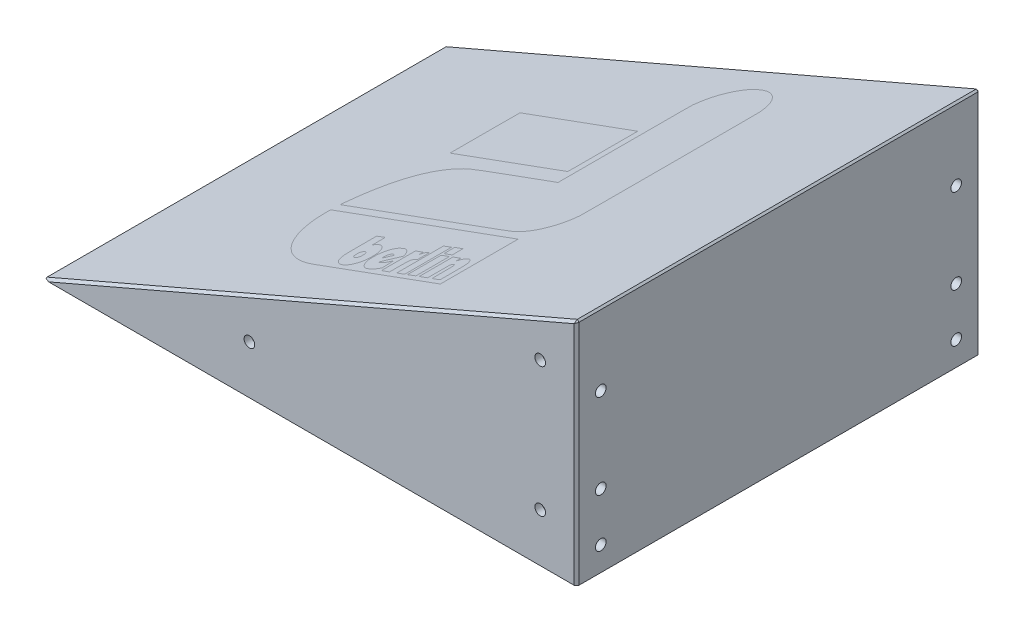
from build123d import *

# Parameters (mm, degrees)
BOSS_EXTRUDE1_DEPTH   = 166.666666667
CUT_EXTRUDE1_DEPTH    = 160.666666667
SKETCH3_R             = 2.2
CUT_EXTRUDE2_DEPTH    = 5
SKETCH4_R             = 2.2
CUT_EXTRUDE3_DEPTH    = 163.666666667
CUT_EXTRUDE4_DEPTH    = 1
BOSS_EXTRUDE2_DEPTH   = 1
BOSS_EXTRUDE2_2_DEPTH = 1
BOSS_EXTRUDE2_3_DEPTH = 1
BOSS_EXTRUDE2_4_DEPTH = 1
BOSS_EXTRUDE2_5_DEPTH = 1


with BuildPart() as part:
    # Sketch1 → Boss-Extrude1 (new body)
    with BuildSketch(Plane.XY):
        Polygon((0, 0), (-220.397368405, 0), (0, 95), align=None)
    extrude(amount=BOSS_EXTRUDE1_DEPTH)

    # Sketch2 → Cut-Extrude1 (cut)
    with BuildSketch(Plane.XY.offset(163.666666667)):
        Polygon((-5, 0), (-5, 87.400090745), (-178.22131418, 12.734839675), (-178.22131418, 0), align=None)
    extrude(amount=-CUT_EXTRUDE1_DEPTH, mode=Mode.SUBTRACT)

    # Sketch3 → Cut-Extrude2 (cut)
    with BuildSketch(Plane(origin=(0, 0, 0), x_dir=(0, 0, -1), z_dir=(1, 0, 0))):
        with Locations((-156.666666667, 10)):
            Circle(SKETCH3_R)
        with Locations((-156.666666667, 65)):
            Circle(SKETCH3_R)
        with Locations((-156.666666667, 30)):
            Circle(SKETCH3_R)
        with Locations((-10, 30)):
            Circle(SKETCH3_R)
        with Locations((-10, 65)):
            Circle(SKETCH3_R)
        with Locations((-10, 10)):
            Circle(SKETCH3_R)
    extrude(amount=-CUT_EXTRUDE2_DEPTH, mode=Mode.SUBTRACT)

    # Sketch4 → Cut-Extrude3 (cut)
    with BuildSketch(Plane(origin=(0, 0, 0), x_dir=(-1, 0, 0), z_dir=(0, 0, -1))):
        with Locations((15, 73.534405559)):
            Circle(SKETCH4_R)
        with Locations((15, 20)):
            Circle(SKETCH4_R)
        with Locations((135, 20)):
            Circle(SKETCH4_R)
    cut_extrude3 = extrude(amount=-CUT_EXTRUDE3_DEPTH, mode=Mode.SUBTRACT)

    # Mirror1: Cut-Extrude3 across plane
    add(cut_extrude3.mirror(Plane(origin=(0, 0, 83.333333333), x_dir=(1, 0, 0), z_dir=(0, 0, -1))), mode=Mode.SUBTRACT)

    # Chamfer1
    # the kernel refuses this chamfer: 1, 0.76094484 mm, written as the material it takes off along each edge
    with BuildSketch(Plane(origin=(-0.566264223, 94.059603605, 0.666666667), x_dir=(-0.6636676001479009, -0.3450951072209674, -0.6636676001479013), z_dir=(0.48166378315170105, 0.48166378315167974, -0.7321202087089269))) as chamfer1_piece_1:
        Polygon((-0.576464838, -0.320947287), (0.930313555, -0.320947287), (-0.353848716, 0.641894573), align=None)
    extrude(amount=1.335162391, mode=Mode.SUBTRACT)
    with BuildSketch(Plane(origin=(-0.566264223, 94.059603605, 166), x_dir=(-0.663667600147901, -0.3450951072209673, 0.6636676001479013), z_dir=(0.4816637831517013, 0.4816637831516795, 0.732120208708927))) as chamfer1_piece_2:
        Polygon((-0.576464838, 0.320947287), (0.930313555, 0.320947287), (-0.353848716, -0.641894573), align=None)
    extrude(amount=1.335162391, mode=Mode.SUBTRACT)
    with BuildSketch(Plane(origin=(-222.759002418, -1.017957849, 0), x_dir=(0.39568367544405514, -0.9179751661981379, -0.027495876610586115), z_dir=(0.9183223683555912, 0.39583333333333354, 0))) as chamfer1_piece_3:
        with BuildLine():
            Line((1.028673195, 0), (-0.056547155, -1.027117794))
            Line((-0.056547155, -1.027117794), (-0.076539593, -1.026567876))
            ThreePointArc((-0.076539593, -1.026567876), (-0.034129227, -0.51339783), (-0.019992438, 0.000549918))
            Line((-0.019992438, 0.000549918), (0.000549918, 0.019992438))
            ThreePointArc((0.000549918, 0.019992438), (0.514497665, 0.00585565), (1.029223113, 0.019992438))
            Line((1.029223113, 0.019992438), (1.028673195, 0))
        make_face()
    extrude(amount=245.143365976, mode=Mode.SUBTRACT)
    with BuildSketch(Plane(origin=(0, 97.571682988, 0), x_dir=(0.027495876610586372, 0, 0.9996219169112968), z_dir=(0, -1, 0))) as chamfer1_piece_4:
        with BuildLine():
            Line((1.028673195, 0), (-0.056547155, 1.027117794))
            Line((-0.056547155, 1.027117794), (-0.076539593, 1.026567876))
            ThreePointArc((-0.076539593, 1.026567876), (-0.034129227, 0.51339783), (-0.019992438, -0.000549918))
            Line((-0.019992438, -0.000549918), (0.000549918, -0.019992438))
            ThreePointArc((0.000549918, -0.019992438), (0.514497665, -0.00585565), (1.029223113, -0.019992438))
            Line((1.029223113, -0.019992438), (1.028673195, 0))
        make_face()
    extrude(amount=100.143365976, mode=Mode.SUBTRACT)
    with BuildSketch(Plane(origin=(0, 97.571682988, 166.666666667), x_dir=(0.027495876610586483, 0, -0.9996219169112968), z_dir=(0, -1, 0))) as chamfer1_piece_5:
        with BuildLine():
            Line((1.028673195, 0), (-0.056547155, -1.027117794))
            Line((-0.056547155, -1.027117794), (-0.076539593, -1.026567876))
            ThreePointArc((-0.076539593, -1.026567876), (-0.034129227, -0.51339783), (-0.019992438, 0.000549918))
            Line((-0.019992438, 0.000549918), (0.000549918, 0.019992438))
            ThreePointArc((0.000549918, 0.019992438), (0.514497665, 0.00585565), (1.029223113, 0.019992438))
            Line((1.029223113, 0.019992438), (1.028673195, 0))
        make_face()
    extrude(amount=100.143365976, mode=Mode.SUBTRACT)
    with BuildSketch(Plane(origin=(-222.759002418, -1.017957849, 166.666666667), x_dir=(0.3956836754440552, -0.9179751661981382, 0.027495876610582105), z_dir=(0.9183223683555912, 0.39583333333333354, 0))) as chamfer1_piece_6:
        with BuildLine():
            Line((1.028673195, 0), (-0.056547155, 1.027117794))
            Line((-0.056547155, 1.027117794), (-0.076539593, 1.026567876))
            ThreePointArc((-0.076539593, 1.026567876), (-0.034129227, 0.51339783), (-0.019992438, -0.000549918))
            Line((-0.019992438, -0.000549918), (0.000549918, -0.019992438))
            ThreePointArc((0.000549918, -0.019992438), (0.514497665, -0.00585565), (1.029223113, -0.019992438))
            Line((1.029223113, -0.019992438), (1.028673195, 0))
        make_face()
    extrude(amount=245.143365976, mode=Mode.SUBTRACT)
    with BuildSketch(Plane(origin=(-220.397368405, 0, -2.571682988), x_dir=(0.9987615609068209, -0.04975283363759973, 0), z_dir=(0, 0, 1))) as chamfer1_piece_7:
        with BuildLine():
            Line((0.747091846, 0), (0.910401862, 0.47889142))
            Line((0.910401862, 0.47889142), (0.901581217, 0.496841245))
            ThreePointArc((0.901581217, 0.496841245), (0.452617424, 0.244703092), (-0.008820645, 0.017949825))
            Line((-0.008820645, 0.017949825), (0.000995057, -0.019975231))
            ThreePointArc((0.000995057, -0.019975231), (0.373616325, -0.001413279), (0.748086903, -0.019975231))
            Line((0.748086903, -0.019975231), (0.747091846, 0))
        make_face()
    extrude(amount=171.810032643, mode=Mode.SUBTRACT)
    with BuildSketch(Plane(origin=(0, 95, -2.571682988), x_dir=(0.027495876610585647, -0.9996219169112968, 0), z_dir=(0, 0, 1))) as chamfer1_piece_8:
        with BuildLine():
            Line((1.028673195, 0), (0.252828256, -0.734306302))
            Line((0.252828256, -0.734306302), (0.234251077, -0.741714974))
            ThreePointArc((0.234251077, -0.741714974), (0.125099763, -0.367677326), (-0.018577179, -0.007408672))
            Line((-0.018577179, -0.007408672), (0.000549918, 0.019992438))
            ThreePointArc((0.000549918, 0.019992438), (0.514497665, 0.00585565), (1.029223113, 0.019992438))
            Line((1.029223113, 0.019992438), (1.028673195, 0))
        make_face()
    extrude(amount=171.810032643, mode=Mode.SUBTRACT)

    # Sketch16 → Cut-Extrude4 (cut)
    # profile 1 of 5: a face of its own
    with BuildSketch(Plane(origin=(-159.962298723, 26.049910039, 9.898936259), x_dir=(0, 0, 1), z_dir=(-0.3958333333333336, 0.9183223683555912, 0))):
        with BuildLine():
            Line((108.335048906, 94.961658234), (108.388348594, 95.212805484))
            Line((108.388348594, 95.212805484), (124.40385, 95.212805484))
            Line((124.40385, 95.212805484), (140.419347188, 95.212805484))
            Line((140.419347188, 95.212805484), (140.419347188, 94.949422594))
            add(Edge.make_bspline(
                [(140.419347188, 94.949422594), (140.419347188, 94.804561687), (139.093014375, 80.878436719), (137.471934375, 64.002474844)],
                knots=[0, 0, 0, 0, 1, 1, 1, 1], degree=3))
            add(Edge.make_bspline(
                [(137.471934375, 64.002474844), (135.850858594, 47.126512969), (134.466568594, 32.640810469), (134.395735781, 31.812024375)],
                knots=[0, 0, 0, 0, 1, 1, 1, 1], degree=3))
            add(Edge.make_bspline(
                [(134.395735781, 31.812024375), (133.879968281, 25.777321875), (131.614136719, 19.773939375), (127.992171094, 14.845616719)],
                knots=[0, 0, 0, 0, 1, 1, 1, 1], degree=3))
            add(Edge.make_bspline(
                [(127.992171094, 14.845616719), (122.84301375, 7.839272813), (115.241623594, 3.113011406), (106.653969844, 1.578322969)],
                knots=[0, 0, 0, 0, 1, 1, 1, 1], degree=3))
            add(Edge.make_bspline(
                [(106.653969844, 1.578322969), (104.650527656, 1.220290312), (101.578872656, 0.999147656), (99.928797187, 1.094149688)],
                knots=[0, 0, 0, 0, 1, 1, 1, 1], degree=3))
            add(Edge.make_bspline(
                [(99.928797187, 1.094149688), (99.375124219, 1.126043437), (99.342766406, 1.144504687), (99.342420469, 1.429012969)],
                knots=[0, 0, 0, 0, 1, 1, 1, 1], degree=3))
            add(Edge.make_bspline(
                [(99.342420469, 1.429012969), (99.341998594, 1.82158875), (108.265165312, 94.632359062), (108.335048906, 94.961658234)],
                knots=[0, 0, 0, 0, 1, 1, 1, 1], degree=3))
        make_face()
        with BuildLine():
            Line((119.01724875, 42.327300938), (119.295433125, 41.638581563))
            Line((119.295433125, 41.638581563), (116.602385625, 41.608712812))
            Line((116.602385625, 41.608712812), (113.909338125, 41.578844063))
            Line((113.909338125, 41.578844063), (113.780923594, 40.12777125))
            add(Edge.make_bspline(
                [(113.780923594, 40.12777125), (113.7102975, 39.329676563), (113.624285625, 38.362760156), (113.589788906, 37.979064844)],
                knots=[0, 0, 0, 0, 1, 1, 1, 1], degree=3))
            Line((113.589788906, 37.979064844), (113.527064531, 37.28143125))
            Line((113.527064531, 37.28143125), (119.870647031, 37.28143125))
            add(Edge.make_bspline(
                [(119.870647031, 37.28143125), (125.070079219, 37.28143125), (126.391282031, 37.3123125), (127.195877813, 37.452615469)],
                knots=[0, 0, 0, 0, 1, 1, 1, 1], degree=3))
            add(Edge.make_bspline(
                [(127.195877813, 37.452615469), (129.693221719, 37.888142344), (131.561680781, 39.17028375), (132.54721875, 41.124742031)],
                knots=[0, 0, 0, 0, 1, 1, 1, 1], degree=3))
            add(Edge.make_bspline(
                [(132.54721875, 41.124742031), (133.732906875, 43.476125625), (133.437796875, 45.939057187), (131.770281094, 47.608914375)],
                knots=[0, 0, 0, 0, 1, 1, 1, 1], degree=3))
            add(Edge.make_bspline(
                [(131.770281094, 47.608914375), (130.986871875, 48.393420469), (130.103689219, 48.889305), (128.862646875, 49.24148625)],
                knots=[0, 0, 0, 0, 1, 1, 1, 1], degree=3))
            add(Edge.make_bspline(
                [(128.862646875, 49.24148625), (127.631269687, 49.590921094), (125.366421094, 49.592984063), (124.092122344, 49.245831563)],
                knots=[0, 0, 0, 0, 1, 1, 1, 1], degree=3))
            add(Edge.make_bspline(
                [(124.092122344, 49.245831563), (121.928608125, 48.656442656), (119.928718125, 47.165232656), (119.19285, 45.592723125)],
                knots=[0, 0, 0, 0, 1, 1, 1, 1], degree=3))
            add(Edge.make_bspline(
                [(119.19285, 45.592723125), (118.684553906, 44.506521562), (118.620222188, 43.310235937), (119.01724875, 42.327300938)],
                knots=[0, 0, 0, 0, 1, 1, 1, 1], degree=3))
        make_face(mode=Mode.SUBTRACT)
        with BuildLine():
            Line((128.494826719, 60.877747969), (128.123091563, 60.820027031))
            Line((128.123091563, 60.820027031), (128.641609687, 60.265683281))
            add(Edge.make_bspline(
                [(128.641609687, 60.265683281), (129.226383281, 59.640519375), (129.761734219, 58.588949531), (129.916511719, 57.761454375)],
                knots=[0, 0, 0, 0, 1, 1, 1, 1], degree=3))
            add(Edge.make_bspline(
                [(129.916511719, 57.761454375), (130.020533437, 57.205326094), (129.895207031, 56.079666562), (129.707552813, 55.884810938)],
                knots=[0, 0, 0, 0, 1, 1, 1, 1], degree=3))
            add(Edge.make_bspline(
                [(129.707552813, 55.884810938), (129.658206094, 55.833565781), (128.599772344, 57.039073594), (127.355485781, 58.563717188)],
                knots=[0, 0, 0, 0, 1, 1, 1, 1], degree=3))
            add(Edge.make_bspline(
                [(127.355485781, 58.563717188), (126.111199219, 60.088365), (125.026879219, 61.407952031), (124.945887656, 61.496132344)],
                knots=[0, 0, 0, 0, 1, 1, 1, 1], degree=3))
            add(Edge.make_bspline(
                [(124.945887656, 61.496132344), (124.819202813, 61.634055937), (124.65390375, 61.584122812), (123.763017656, 61.138795781)],
                knots=[0, 0, 0, 0, 1, 1, 1, 1], degree=3))
            add(Edge.make_bspline(
                [(123.763017656, 61.138795781), (122.021361562, 60.268201875), (120.893968125, 59.131539844), (120.24959625, 57.596497031)],
                knots=[0, 0, 0, 0, 1, 1, 1, 1], degree=3))
            add(Edge.make_bspline(
                [(120.24959625, 57.596497031), (119.978904375, 56.951648437), (119.944580625, 56.728202344), (119.940956719, 55.587317344)],
                knots=[0, 0, 0, 0, 1, 1, 1, 1], degree=3))
            add(Edge.make_bspline(
                [(119.940956719, 55.587317344), (119.937159844, 54.36932625), (119.955216094, 54.264924844), (120.295745156, 53.546032969)],
                knots=[0, 0, 0, 0, 1, 1, 1, 1], degree=3))
            add(Edge.make_bspline(
                [(120.295745156, 53.546032969), (121.098775781, 51.850690313), (122.710161094, 50.721605156), (124.959826406, 50.277952969)],
                knots=[0, 0, 0, 0, 1, 1, 1, 1], degree=3))
            add(Edge.make_bspline(
                [(124.959826406, 50.277952969), (125.945689219, 50.083531875), (128.169628594, 50.142839063), (129.089809688, 50.388087656)],
                knots=[0, 0, 0, 0, 1, 1, 1, 1], degree=3))
            add(Edge.make_bspline(
                [(129.089809688, 50.388087656), (130.409071875, 50.739703594), (131.575632187, 51.415699219), (132.556158281, 52.396756875)],
                knots=[0, 0, 0, 0, 1, 1, 1, 1], degree=3))
            add(Edge.make_bspline(
                [(132.556158281, 52.396756875), (133.59326625, 53.434434375), (134.071837031, 54.286630313), (134.347899375, 55.587317344)],
                knots=[0, 0, 0, 0, 1, 1, 1, 1], degree=3))
            add(Edge.make_bspline(
                [(134.347899375, 55.587317344), (134.577407812, 56.668675781), (134.500584375, 58.281157969), (134.175390469, 59.208173437)],
                knots=[0, 0, 0, 0, 1, 1, 1, 1], degree=3))
            add(Edge.make_bspline(
                [(134.175390469, 59.208173437), (133.991001563, 59.733800156), (133.387408125, 60.95435625), (133.215135469, 61.149962812)],
                knots=[0, 0, 0, 0, 1, 1, 1, 1], degree=3))
            add(Edge.make_bspline(
                [(133.215135469, 61.149962812), (133.173833906, 61.196837344), (128.99948625, 60.956107031), (128.494826719, 60.877747969)],
                knots=[0, 0, 0, 0, 1, 1, 1, 1], degree=3))
        make_face(mode=Mode.SUBTRACT)
        with BuildLine():
            Line((135.347283281, 66.609898594), (135.400654688, 66.861049219))
            Line((135.400654688, 66.861049219), (131.735290781, 66.861049219))
            add(Edge.make_bspline(
                [(131.735290781, 66.861049219), (127.660733438, 66.861049219), (127.220304375, 66.918955781), (126.63307125, 67.531889531)],
                knots=[0, 0, 0, 0, 1, 1, 1, 1], degree=3))
            add(Edge.make_bspline(
                [(126.63307125, 67.531889531), (126.348676875, 67.828737656), (126.300439688, 67.974259219), (126.262217813, 68.650727344)],
                knots=[0, 0, 0, 0, 1, 1, 1, 1], degree=3))
            Line((126.262217813, 68.650727344), (126.218279531, 69.428331563))
            Line((126.218279531, 69.428331563), (123.649208437, 69.428331563))
            Line((123.649208437, 69.428331563), (121.080137344, 69.428331563))
            Line((121.080137344, 69.428331563), (121.156488281, 68.852771719))
            add(Edge.make_bspline(
                [(121.156488281, 68.852771719), (121.285489219, 67.880345625), (121.732735781, 67.295065781), (122.671593281, 66.870077344)],
                knots=[0, 0, 0, 0, 1, 1, 1, 1], degree=3))
            Line((122.671593281, 66.870077344), (123.173890312, 66.642707813))
            Line((123.173890312, 66.642707813), (122.249511562, 66.640176563))
            add(Edge.make_bspline(
                [(122.249511562, 66.640176563), (121.6107675, 66.638489063), (121.3109325, 66.594609844), (121.279169531, 66.49819875)],
                knots=[0, 0, 0, 0, 1, 1, 1, 1], degree=3))
            add(Edge.make_bspline(
                [(121.279169531, 66.49819875), (121.253899219, 66.421459687), (121.165410938, 65.542440937), (121.082550469, 64.544828906)],
                knots=[0, 0, 0, 0, 1, 1, 1, 1], degree=3))
            Line((121.082550469, 64.544828906), (120.931898906, 62.730985781))
            Line((120.931898906, 62.730985781), (127.93109625, 62.730985781))
            Line((127.93109625, 62.730985781), (134.930293594, 62.730985781))
            Line((134.930293594, 62.730985781), (134.99379, 63.149646094))
            add(Edge.make_bspline(
                [(134.99379, 63.149646094), (135.02872125, 63.379863281), (135.11053125, 64.196094375), (135.17560125, 64.963489219)],
                knots=[0, 0, 0, 0, 1, 1, 1, 1], degree=3))
            add(Edge.make_bspline(
                [(135.17560125, 64.963489219), (135.24067125, 65.730884063), (135.317929219, 66.471768281), (135.347283281, 66.609898594)],
                knots=[0, 0, 0, 0, 1, 1, 1, 1], degree=3))
        make_face(mode=Mode.SUBTRACT)
        with BuildLine():
            Line((136.028100938, 73.753651406), (136.096955156, 74.451280781))
            Line((136.096955156, 74.451280781), (126.444708281, 74.451280781))
            Line((126.444708281, 74.451280781), (116.792461406, 74.451280781))
            Line((116.792461406, 74.451280781), (116.657301094, 73.028110781))
            add(Edge.make_bspline(
                [(116.657301094, 73.028110781), (116.5829625, 72.245368125), (116.492423906, 71.341239375), (116.456108906, 71.018931094)],
                knots=[0, 0, 0, 0, 1, 1, 1, 1], degree=3))
            Line((116.456108906, 71.018931094), (116.390077031, 70.432921406))
            Line((116.390077031, 70.432921406), (126.044319375, 70.432921406))
            Line((126.044319375, 70.432921406), (135.698561719, 70.432921406))
            Line((135.698561719, 70.432921406), (135.828904219, 71.744471719))
            add(Edge.make_bspline(
                [(135.828904219, 71.744471719), (135.900597656, 72.465823125), (135.990233437, 73.369951875), (136.028100938, 73.753651406)],
                knots=[0, 0, 0, 0, 1, 1, 1, 1], degree=3))
        make_face(mode=Mode.SUBTRACT)
        with BuildLine():
            Line((121.548076875, 79.78354875), (121.555375313, 80.037057656))
            Line((121.555375313, 80.037057656), (119.350859062, 80.006809219))
            Line((119.350859062, 80.006809219), (117.146342813, 79.976560781))
            Line((117.146342813, 79.976560781), (116.958182344, 78.246434531))
            add(Edge.make_bspline(
                [(116.958182344, 78.246434531), (116.854696406, 77.294861719), (116.766794531, 76.351996406), (116.762845781, 76.151175469)],
                knots=[0, 0, 0, 0, 1, 1, 1, 1], degree=3))
            Line((116.762845781, 76.151175469), (116.755673906, 75.786051094))
            Line((116.755673906, 75.786051094), (118.960190156, 75.816299531))
            Line((118.960190156, 75.816299531), (121.164706406, 75.846547969))
            Line((121.164706406, 75.846547969), (121.352740313, 77.688293906))
            add(Edge.make_bspline(
                [(121.352740313, 77.688293906), (121.45615875, 78.70125375), (121.544060625, 79.644119063), (121.548076875, 79.78354875)],
                knots=[0, 0, 0, 0, 1, 1, 1, 1], degree=3))
        make_face(mode=Mode.SUBTRACT)
        with BuildLine():
            Line((129.58565625, 80.005298906), (122.727407344, 79.976527031))
            Line((122.727407344, 79.976527031), (122.542335, 78.246400781))
            add(Edge.make_bspline(
                [(122.542335, 78.246400781), (122.440545, 77.294827969), (122.352643125, 76.353025781), (122.346998437, 76.153504219)],
                knots=[0, 0, 0, 0, 1, 1, 1, 1], degree=3))
            Line((122.346998437, 76.153504219), (122.336746875, 75.790733906))
            Line((122.336746875, 75.790733906), (129.252197812, 75.790733906))
            Line((129.252197812, 75.790733906), (136.16764875, 75.790733906))
            Line((136.16764875, 75.790733906), (136.2258, 76.153504219))
            add(Edge.make_bspline(
                [(136.2258, 76.153504219), (136.400966719, 77.245924219), (136.61537625, 79.862595469), (136.536211406, 79.941764531)],
                knots=[0, 0, 0, 0, 1, 1, 1, 1], degree=3))
            add(Edge.make_bspline(
                [(136.536211406, 79.941764531), (136.485442969, 79.992532969), (133.35769125, 80.021123438), (129.58565625, 80.005298906)],
                knots=[0, 0, 0, 0, 1, 1, 1, 1], degree=3))
        make_face(mode=Mode.SUBTRACT)
        with BuildLine():
            Line((137.737137656, 91.780457063), (137.740512656, 92.199035953))
            Line((137.740512656, 92.199035953), (132.727384688, 92.199035953))
            add(Edge.make_bspline(
                [(132.727384688, 92.199035953), (127.089046406, 92.199035953), (126.529783594, 92.145284859), (125.1612675, 91.471849594)],
                knots=[0, 0, 0, 0, 1, 1, 1, 1], degree=3))
            add(Edge.make_bspline(
                [(125.1612675, 91.471849594), (122.879067187, 90.348798938), (122.60629125, 88.045544109), (124.545578906, 86.273143453)],
                knots=[0, 0, 0, 0, 1, 1, 1, 1], degree=3))
            Line((124.545578906, 86.273143453), (125.145320625, 85.725012234))
            Line((125.145320625, 85.725012234), (124.18754625, 85.725012234))
            add(Edge.make_bspline(
                [(124.18754625, 85.725012234), (123.350639062, 85.725012234), (123.229493437, 85.700362078), (123.227552813, 85.529675672)],
                knots=[0, 0, 0, 0, 1, 1, 1, 1], degree=3))
            add(Edge.make_bspline(
                [(123.227552813, 85.529675672), (123.226287188, 85.422240141), (123.151986562, 84.656240438), (123.062342344, 83.827453922)],
                knots=[0, 0, 0, 0, 1, 1, 1, 1], degree=3))
            add(Edge.make_bspline(
                [(123.062342344, 83.827453922), (122.972693906, 82.998666563), (122.898346875, 82.182439687), (122.897127656, 82.013609531)],
                knots=[0, 0, 0, 0, 1, 1, 1, 1], degree=3))
            Line((122.897127656, 82.013609531), (122.895018281, 81.706653281))
            Line((122.895018281, 81.706653281), (129.81340125, 81.706653281))
            Line((129.81340125, 81.706653281), (136.73178, 81.706653281))
            Line((136.73178, 81.706653281), (136.786121719, 81.957799688))
            add(Edge.make_bspline(
                [(136.786121719, 81.957799688), (136.839923438, 82.205621719), (137.18298375, 85.538081109), (137.182557656, 85.808728266)],
                knots=[0, 0, 0, 0, 1, 1, 1, 1], degree=3))
            add(Edge.make_bspline(
                [(137.182557656, 85.808728266), (137.182384687, 85.91792175), (136.2511125, 85.948254562), (132.898876875, 85.948254562)],
                knots=[0, 0, 0, 0, 1, 1, 1, 1], degree=3))
            add(Edge.make_bspline(
                [(132.898876875, 85.948254562), (130.542975, 85.948254562), (128.459165625, 85.979507063), (128.268187031, 86.017700672)],
                knots=[0, 0, 0, 0, 1, 1, 1, 1], degree=3))
            add(Edge.make_bspline(
                [(128.268187031, 86.017700672), (127.067395781, 86.257859344), (127.063029375, 87.616255078), (128.261943281, 87.960100078)],
                knots=[0, 0, 0, 0, 1, 1, 1, 1], degree=3))
            add(Edge.make_bspline(
                [(128.261943281, 87.960100078), (128.480069531, 88.022657812), (130.507824375, 88.069055625), (133.023713906, 88.069055625)],
                knots=[0, 0, 0, 0, 1, 1, 1, 1], degree=3))
            add(Edge.make_bspline(
                [(133.023713906, 88.069055625), (135.433738125, 88.069055625), (137.406623906, 88.106729063), (137.407897969, 88.152771234)],
                knots=[0, 0, 0, 0, 1, 1, 1, 1], degree=3))
            add(Edge.make_bspline(
                [(137.407897969, 88.152771234), (137.409163594, 88.198815094), (137.483029688, 88.939700156), (137.572024219, 89.799182297)],
                knots=[0, 0, 0, 0, 1, 1, 1, 1], degree=3))
            add(Edge.make_bspline(
                [(137.572024219, 89.799182297), (137.66101875, 90.658664859), (137.735319375, 91.550238609), (137.737137656, 91.780457063)],
                knots=[0, 0, 0, 0, 1, 1, 1, 1], degree=3))
        make_face(mode=Mode.SUBTRACT)
    # profile 2 of 5: a face of its own
    with BuildSketch(Plane(origin=(-159.962298723, 26.049910039, 9.898936259), x_dir=(0, 0, 1), z_dir=(-0.3958333333333336, 0.9183223683555912, 0))):
        with BuildLine():
            Line((70.7201685, 71.686911094), (70.788255328, 72.215360156))
            Line((70.788255328, 72.215360156), (43.347138609, 72.248477344))
            add(Edge.make_bspline(
                [(43.347138609, 72.248477344), (17.425446469, 72.279738281), (15.859668375, 72.292660313), (15.068864109, 72.481508437)],
                knots=[0, 0, 0, 0, 1, 1, 1, 1], degree=3))
            add(Edge.make_bspline(
                [(15.068864109, 72.481508437), (11.944744312, 73.227564844), (9.407080547, 74.566680469), (7.324513594, 76.568177813)],
                knots=[0, 0, 0, 0, 1, 1, 1, 1], degree=3))
            add(Edge.make_bspline(
                [(7.324513594, 76.568177813), (4.972325062, 78.828803438), (3.43194975, 81.56446875), (2.734214906, 84.720426609)],
                knots=[0, 0, 0, 0, 1, 1, 1, 1], degree=3))
            add(Edge.make_bspline(
                [(2.734214906, 84.720426609), (2.443447687, 86.035608844), (2.382855469, 89.118858234), (2.619777516, 90.543568922)],
                knots=[0, 0, 0, 0, 1, 1, 1, 1], degree=3))
            add(Edge.make_bspline(
                [(2.619777516, 90.543568922), (3.793157859, 97.599583547), (9.417378516, 102.899060859), (16.575748875, 103.693719375)],
                knots=[0, 0, 0, 0, 1, 1, 1, 1], degree=3))
            add(Edge.make_bspline(
                [(16.575748875, 103.693719375), (17.377902, 103.782767062), (27.867430688, 103.806955266), (53.857192781, 103.779687797)],
                knots=[0, 0, 0, 0, 1, 1, 1, 1], degree=3))
            add(Edge.make_bspline(
                [(53.857192781, 103.779687797), (87.770680313, 103.744106859), (90.081500625, 103.729587609), (90.971205469, 103.546494703)],
                knots=[0, 0, 0, 0, 1, 1, 1, 1], degree=3))
            add(Edge.make_bspline(
                [(90.971205469, 103.546494703), (97.167237188, 102.271412953), (101.816244844, 97.856373375), (103.384468125, 91.757949609)],
                knots=[0, 0, 0, 0, 1, 1, 1, 1], degree=3))
            add(Edge.make_bspline(
                [(103.384468125, 91.757949609), (103.656923437, 90.698443875), (103.726612969, 90.160840125), (103.775858438, 88.738786406)],
                knots=[0, 0, 0, 0, 1, 1, 1, 1], degree=3))
            add(Edge.make_bspline(
                [(103.775858438, 88.738786406), (103.833372656, 87.0778755), (103.671208125, 85.297227609), (99.722458125, 44.229872812)],
                knots=[0, 0, 0, 0, 1, 1, 1, 1], degree=3))
            Line((99.722458125, 44.229872812), (95.609151562, 1.451089687))
            Line((95.609151562, 1.451089687), (95.327263125, 1.458092813))
            add(Edge.make_bspline(
                [(95.327263125, 1.458092813), (95.172224063, 1.461889688), (94.342163906, 1.613304844), (93.482677969, 1.794445313)],
                knots=[0, 0, 0, 0, 1, 1, 1, 1], degree=3))
            add(Edge.make_bspline(
                [(93.482677969, 1.794445313), (86.4282825, 3.281196094), (80.66712375, 5.688638437), (76.303109531, 8.973352969)],
                knots=[0, 0, 0, 0, 1, 1, 1, 1], degree=3))
            add(Edge.make_bspline(
                [(76.303109531, 8.973352969), (70.705209656, 13.186795781), (67.547969719, 18.781461563), (66.853427625, 25.718301562)],
                knots=[0, 0, 0, 0, 1, 1, 1, 1], degree=3))
            add(Edge.make_bspline(
                [(66.853427625, 25.718301562), (66.576264188, 28.486510313), (66.707643656, 30.269214844), (68.746201875, 51.401524219)],
                knots=[0, 0, 0, 0, 1, 1, 1, 1], degree=3))
            add(Edge.make_bspline(
                [(68.746201875, 51.401524219), (69.794435953, 62.26783875), (70.682721188, 71.396260312), (70.7201685, 71.686911094)],
                knots=[0, 0, 0, 0, 1, 1, 1, 1], degree=3))
        make_face()
    # profile 3 of 5: a face of its own
    with BuildSketch(Plane(origin=(-159.962298723, 26.049910039, 9.898936259), x_dir=(0, 0, 1), z_dir=(-0.3958333333333336, 0.9183223683555912, 0))):
        with BuildLine():
            Line((34.552462359, 68.172595313), (34.616233406, 68.646985313))
            Line((34.616233406, 68.646985313), (49.008514641, 68.646985313))
            add(Edge.make_bspline(
                [(49.008514641, 68.646985313), (62.640611719, 68.646985313), (63.400854938, 68.636649375), (63.401908781, 68.45164875)],
                knots=[0, 0, 0, 0, 1, 1, 1, 1], degree=3))
            add(Edge.make_bspline(
                [(63.401908781, 68.45164875), (63.403722844, 68.136550313), (57.815834906, 10.015017187), (57.75720525, 9.738950625)],
                knots=[0, 0, 0, 0, 1, 1, 1, 1], degree=3))
            Line((57.75720525, 9.738950625), (57.703867172, 9.487804219))
            Line((57.703867172, 9.487804219), (43.306873172, 9.487804219))
            add(Edge.make_bspline(
                [(43.306873172, 9.487804219), (35.388526641, 9.487804219), (28.909879172, 9.523072969), (28.909879172, 9.566213906)],
                knots=[0, 0, 0, 0, 1, 1, 1, 1], degree=3))
            add(Edge.make_bspline(
                [(28.909879172, 9.566213906), (28.909879172, 9.74041875), (34.493359359, 67.732929844), (34.552462359, 68.172595313)],
                knots=[0, 0, 0, 0, 1, 1, 1, 1], degree=3))
        make_face()
    # profile 4 of 5: a face of its own
    with BuildSketch(Plane(origin=(-159.962298723, 26.049910039, 9.898936259), x_dir=(0, 0, 1), z_dir=(-0.3958333333333336, 0.9183223683555912, 0))):
        with BuildLine():
            add(Edge.make_bspline(
                [(124.683000469, 41.830180312), (124.206627656, 42.069526875), (123.787807031, 42.670618594), (123.787807031, 43.114966875)],
                knots=[0, 0, 0, 0, 1, 1, 1, 1], degree=3))
            add(Edge.make_bspline(
                [(123.787807031, 43.114966875), (123.787807031, 44.073306563), (124.844789531, 44.901805781), (126.060970781, 44.8967475)],
                knots=[0, 0, 0, 0, 1, 1, 1, 1], degree=3))
            add(Edge.make_bspline(
                [(126.060970781, 44.8967475), (126.437608125, 44.89506), (126.896452031, 44.835330938), (127.08063, 44.76373875)],
                knots=[0, 0, 0, 0, 1, 1, 1, 1], degree=3))
            add(Edge.make_bspline(
                [(127.08063, 44.76373875), (128.513140313, 44.206918594), (128.398419844, 42.438604219), (126.888875156, 41.808031875)],
                knots=[0, 0, 0, 0, 1, 1, 1, 1], degree=3))
            add(Edge.make_bspline(
                [(126.888875156, 41.808031875), (126.323440313, 41.571836719), (125.174244375, 41.583379219), (124.683000469, 41.830180312)],
                knots=[0, 0, 0, 0, 1, 1, 1, 1], degree=3))
        make_face()
    # profile 5 of 5: a face of its own
    with BuildSketch(Plane(origin=(-159.962298723, 26.049910039, 9.898936259), x_dir=(0, 0, 1), z_dir=(-0.3958333333333336, 0.9183223683555912, 0))):
        with BuildLine():
            add(Edge.make_bspline(
                [(125.323609219, 54.406691719), (124.344838125, 54.756021094), (123.948127969, 55.286685), (124.04215125, 56.120858438)],
                knots=[0, 0, 0, 0, 1, 1, 1, 1], degree=3))
            add(Edge.make_bspline(
                [(124.04215125, 56.120858438), (124.103964375, 56.669257969), (124.438085156, 57.205823906), (124.717762969, 57.205823906)],
                knots=[0, 0, 0, 0, 1, 1, 1, 1], degree=3))
            add(Edge.make_bspline(
                [(124.717762969, 57.205823906), (124.816941562, 57.205823906), (125.405486719, 56.579934375), (126.025642969, 55.814956875)],
                knots=[0, 0, 0, 0, 1, 1, 1, 1], degree=3))
            add(Edge.make_bspline(
                [(126.025642969, 55.814956875), (126.991534219, 54.623514375), (127.123990312, 54.412585312), (126.949481719, 54.343823906)],
                knots=[0, 0, 0, 0, 1, 1, 1, 1], degree=3))
            add(Edge.make_bspline(
                [(126.949481719, 54.343823906), (126.61889625, 54.213565781), (125.773095938, 54.246269531), (125.323609219, 54.406691719)],
                knots=[0, 0, 0, 0, 1, 1, 1, 1], degree=3))
        make_face()
    extrude(amount=-CUT_EXTRUDE4_DEPTH, mode=Mode.SUBTRACT)


with BuildPart() as body_2:
    # Sketch16<3> → Boss-Extrude2 (new body)
    with BuildSketch(Plane(origin=(-159.962298723, 26.049910039, 9.898936259), x_dir=(0, 0, 1), z_dir=(-0.3958333333333336, 0.9183223683555912, 0))):
        with BuildLine():
            Line((108.335048906, 94.961658234), (108.388348594, 95.212805484))
            Line((108.388348594, 95.212805484), (124.40385, 95.212805484))
            Line((124.40385, 95.212805484), (140.419347188, 95.212805484))
            Line((140.419347188, 95.212805484), (140.419347188, 94.949422594))
            add(Edge.make_bspline(
                [(140.419347188, 94.949422594), (140.419347188, 94.804561687), (139.093014375, 80.878436719), (137.471934375, 64.002474844)],
                knots=[0, 0, 0, 0, 1, 1, 1, 1], degree=3))
            add(Edge.make_bspline(
                [(137.471934375, 64.002474844), (135.850858594, 47.126512969), (134.466568594, 32.640810469), (134.395735781, 31.812024375)],
                knots=[0, 0, 0, 0, 1, 1, 1, 1], degree=3))
            add(Edge.make_bspline(
                [(134.395735781, 31.812024375), (133.879968281, 25.777321875), (131.614136719, 19.773939375), (127.992171094, 14.845616719)],
                knots=[0, 0, 0, 0, 1, 1, 1, 1], degree=3))
            add(Edge.make_bspline(
                [(127.992171094, 14.845616719), (122.84301375, 7.839272813), (115.241623594, 3.113011406), (106.653969844, 1.578322969)],
                knots=[0, 0, 0, 0, 1, 1, 1, 1], degree=3))
            add(Edge.make_bspline(
                [(106.653969844, 1.578322969), (104.650527656, 1.220290312), (101.578872656, 0.999147656), (99.928797187, 1.094149688)],
                knots=[0, 0, 0, 0, 1, 1, 1, 1], degree=3))
            add(Edge.make_bspline(
                [(99.928797187, 1.094149688), (99.375124219, 1.126043437), (99.342766406, 1.144504687), (99.342420469, 1.429012969)],
                knots=[0, 0, 0, 0, 1, 1, 1, 1], degree=3))
            add(Edge.make_bspline(
                [(99.342420469, 1.429012969), (99.341998594, 1.82158875), (108.265165312, 94.632359062), (108.335048906, 94.961658234)],
                knots=[0, 0, 0, 0, 1, 1, 1, 1], degree=3))
        make_face()
        with BuildLine():
            Line((119.01724875, 42.327300938), (119.295433125, 41.638581563))
            Line((119.295433125, 41.638581563), (116.602385625, 41.608712812))
            Line((116.602385625, 41.608712812), (113.909338125, 41.578844063))
            Line((113.909338125, 41.578844063), (113.780923594, 40.12777125))
            add(Edge.make_bspline(
                [(113.780923594, 40.12777125), (113.7102975, 39.329676563), (113.624285625, 38.362760156), (113.589788906, 37.979064844)],
                knots=[0, 0, 0, 0, 1, 1, 1, 1], degree=3))
            Line((113.589788906, 37.979064844), (113.527064531, 37.28143125))
            Line((113.527064531, 37.28143125), (119.870647031, 37.28143125))
            add(Edge.make_bspline(
                [(119.870647031, 37.28143125), (125.070079219, 37.28143125), (126.391282031, 37.3123125), (127.195877813, 37.452615469)],
                knots=[0, 0, 0, 0, 1, 1, 1, 1], degree=3))
            add(Edge.make_bspline(
                [(127.195877813, 37.452615469), (129.693221719, 37.888142344), (131.561680781, 39.17028375), (132.54721875, 41.124742031)],
                knots=[0, 0, 0, 0, 1, 1, 1, 1], degree=3))
            add(Edge.make_bspline(
                [(132.54721875, 41.124742031), (133.732906875, 43.476125625), (133.437796875, 45.939057187), (131.770281094, 47.608914375)],
                knots=[0, 0, 0, 0, 1, 1, 1, 1], degree=3))
            add(Edge.make_bspline(
                [(131.770281094, 47.608914375), (130.986871875, 48.393420469), (130.103689219, 48.889305), (128.862646875, 49.24148625)],
                knots=[0, 0, 0, 0, 1, 1, 1, 1], degree=3))
            add(Edge.make_bspline(
                [(128.862646875, 49.24148625), (127.631269687, 49.590921094), (125.366421094, 49.592984063), (124.092122344, 49.245831563)],
                knots=[0, 0, 0, 0, 1, 1, 1, 1], degree=3))
            add(Edge.make_bspline(
                [(124.092122344, 49.245831563), (121.928608125, 48.656442656), (119.928718125, 47.165232656), (119.19285, 45.592723125)],
                knots=[0, 0, 0, 0, 1, 1, 1, 1], degree=3))
            add(Edge.make_bspline(
                [(119.19285, 45.592723125), (118.684553906, 44.506521562), (118.620222188, 43.310235937), (119.01724875, 42.327300938)],
                knots=[0, 0, 0, 0, 1, 1, 1, 1], degree=3))
        make_face(mode=Mode.SUBTRACT)
        with BuildLine():
            Line((128.494826719, 60.877747969), (128.123091563, 60.820027031))
            Line((128.123091563, 60.820027031), (128.641609687, 60.265683281))
            add(Edge.make_bspline(
                [(128.641609687, 60.265683281), (129.226383281, 59.640519375), (129.761734219, 58.588949531), (129.916511719, 57.761454375)],
                knots=[0, 0, 0, 0, 1, 1, 1, 1], degree=3))
            add(Edge.make_bspline(
                [(129.916511719, 57.761454375), (130.020533437, 57.205326094), (129.895207031, 56.079666562), (129.707552813, 55.884810938)],
                knots=[0, 0, 0, 0, 1, 1, 1, 1], degree=3))
            add(Edge.make_bspline(
                [(129.707552813, 55.884810938), (129.658206094, 55.833565781), (128.599772344, 57.039073594), (127.355485781, 58.563717188)],
                knots=[0, 0, 0, 0, 1, 1, 1, 1], degree=3))
            add(Edge.make_bspline(
                [(127.355485781, 58.563717188), (126.111199219, 60.088365), (125.026879219, 61.407952031), (124.945887656, 61.496132344)],
                knots=[0, 0, 0, 0, 1, 1, 1, 1], degree=3))
            add(Edge.make_bspline(
                [(124.945887656, 61.496132344), (124.819202813, 61.634055937), (124.65390375, 61.584122812), (123.763017656, 61.138795781)],
                knots=[0, 0, 0, 0, 1, 1, 1, 1], degree=3))
            add(Edge.make_bspline(
                [(123.763017656, 61.138795781), (122.021361562, 60.268201875), (120.893968125, 59.131539844), (120.24959625, 57.596497031)],
                knots=[0, 0, 0, 0, 1, 1, 1, 1], degree=3))
            add(Edge.make_bspline(
                [(120.24959625, 57.596497031), (119.978904375, 56.951648437), (119.944580625, 56.728202344), (119.940956719, 55.587317344)],
                knots=[0, 0, 0, 0, 1, 1, 1, 1], degree=3))
            add(Edge.make_bspline(
                [(119.940956719, 55.587317344), (119.937159844, 54.36932625), (119.955216094, 54.264924844), (120.295745156, 53.546032969)],
                knots=[0, 0, 0, 0, 1, 1, 1, 1], degree=3))
            add(Edge.make_bspline(
                [(120.295745156, 53.546032969), (121.098775781, 51.850690313), (122.710161094, 50.721605156), (124.959826406, 50.277952969)],
                knots=[0, 0, 0, 0, 1, 1, 1, 1], degree=3))
            add(Edge.make_bspline(
                [(124.959826406, 50.277952969), (125.945689219, 50.083531875), (128.169628594, 50.142839063), (129.089809688, 50.388087656)],
                knots=[0, 0, 0, 0, 1, 1, 1, 1], degree=3))
            add(Edge.make_bspline(
                [(129.089809688, 50.388087656), (130.409071875, 50.739703594), (131.575632187, 51.415699219), (132.556158281, 52.396756875)],
                knots=[0, 0, 0, 0, 1, 1, 1, 1], degree=3))
            add(Edge.make_bspline(
                [(132.556158281, 52.396756875), (133.59326625, 53.434434375), (134.071837031, 54.286630313), (134.347899375, 55.587317344)],
                knots=[0, 0, 0, 0, 1, 1, 1, 1], degree=3))
            add(Edge.make_bspline(
                [(134.347899375, 55.587317344), (134.577407812, 56.668675781), (134.500584375, 58.281157969), (134.175390469, 59.208173437)],
                knots=[0, 0, 0, 0, 1, 1, 1, 1], degree=3))
            add(Edge.make_bspline(
                [(134.175390469, 59.208173437), (133.991001563, 59.733800156), (133.387408125, 60.95435625), (133.215135469, 61.149962812)],
                knots=[0, 0, 0, 0, 1, 1, 1, 1], degree=3))
            add(Edge.make_bspline(
                [(133.215135469, 61.149962812), (133.173833906, 61.196837344), (128.99948625, 60.956107031), (128.494826719, 60.877747969)],
                knots=[0, 0, 0, 0, 1, 1, 1, 1], degree=3))
        make_face(mode=Mode.SUBTRACT)
        with BuildLine():
            Line((135.347283281, 66.609898594), (135.400654688, 66.861049219))
            Line((135.400654688, 66.861049219), (131.735290781, 66.861049219))
            add(Edge.make_bspline(
                [(131.735290781, 66.861049219), (127.660733438, 66.861049219), (127.220304375, 66.918955781), (126.63307125, 67.531889531)],
                knots=[0, 0, 0, 0, 1, 1, 1, 1], degree=3))
            add(Edge.make_bspline(
                [(126.63307125, 67.531889531), (126.348676875, 67.828737656), (126.300439688, 67.974259219), (126.262217813, 68.650727344)],
                knots=[0, 0, 0, 0, 1, 1, 1, 1], degree=3))
            Line((126.262217813, 68.650727344), (126.218279531, 69.428331563))
            Line((126.218279531, 69.428331563), (123.649208437, 69.428331563))
            Line((123.649208437, 69.428331563), (121.080137344, 69.428331563))
            Line((121.080137344, 69.428331563), (121.156488281, 68.852771719))
            add(Edge.make_bspline(
                [(121.156488281, 68.852771719), (121.285489219, 67.880345625), (121.732735781, 67.295065781), (122.671593281, 66.870077344)],
                knots=[0, 0, 0, 0, 1, 1, 1, 1], degree=3))
            Line((122.671593281, 66.870077344), (123.173890312, 66.642707813))
            Line((123.173890312, 66.642707813), (122.249511562, 66.640176563))
            add(Edge.make_bspline(
                [(122.249511562, 66.640176563), (121.6107675, 66.638489063), (121.3109325, 66.594609844), (121.279169531, 66.49819875)],
                knots=[0, 0, 0, 0, 1, 1, 1, 1], degree=3))
            add(Edge.make_bspline(
                [(121.279169531, 66.49819875), (121.253899219, 66.421459687), (121.165410938, 65.542440937), (121.082550469, 64.544828906)],
                knots=[0, 0, 0, 0, 1, 1, 1, 1], degree=3))
            Line((121.082550469, 64.544828906), (120.931898906, 62.730985781))
            Line((120.931898906, 62.730985781), (127.93109625, 62.730985781))
            Line((127.93109625, 62.730985781), (134.930293594, 62.730985781))
            Line((134.930293594, 62.730985781), (134.99379, 63.149646094))
            add(Edge.make_bspline(
                [(134.99379, 63.149646094), (135.02872125, 63.379863281), (135.11053125, 64.196094375), (135.17560125, 64.963489219)],
                knots=[0, 0, 0, 0, 1, 1, 1, 1], degree=3))
            add(Edge.make_bspline(
                [(135.17560125, 64.963489219), (135.24067125, 65.730884063), (135.317929219, 66.471768281), (135.347283281, 66.609898594)],
                knots=[0, 0, 0, 0, 1, 1, 1, 1], degree=3))
        make_face(mode=Mode.SUBTRACT)
        with BuildLine():
            Line((136.028100938, 73.753651406), (136.096955156, 74.451280781))
            Line((136.096955156, 74.451280781), (126.444708281, 74.451280781))
            Line((126.444708281, 74.451280781), (116.792461406, 74.451280781))
            Line((116.792461406, 74.451280781), (116.657301094, 73.028110781))
            add(Edge.make_bspline(
                [(116.657301094, 73.028110781), (116.5829625, 72.245368125), (116.492423906, 71.341239375), (116.456108906, 71.018931094)],
                knots=[0, 0, 0, 0, 1, 1, 1, 1], degree=3))
            Line((116.456108906, 71.018931094), (116.390077031, 70.432921406))
            Line((116.390077031, 70.432921406), (126.044319375, 70.432921406))
            Line((126.044319375, 70.432921406), (135.698561719, 70.432921406))
            Line((135.698561719, 70.432921406), (135.828904219, 71.744471719))
            add(Edge.make_bspline(
                [(135.828904219, 71.744471719), (135.900597656, 72.465823125), (135.990233437, 73.369951875), (136.028100938, 73.753651406)],
                knots=[0, 0, 0, 0, 1, 1, 1, 1], degree=3))
        make_face(mode=Mode.SUBTRACT)
        with BuildLine():
            Line((121.548076875, 79.78354875), (121.555375313, 80.037057656))
            Line((121.555375313, 80.037057656), (119.350859062, 80.006809219))
            Line((119.350859062, 80.006809219), (117.146342813, 79.976560781))
            Line((117.146342813, 79.976560781), (116.958182344, 78.246434531))
            add(Edge.make_bspline(
                [(116.958182344, 78.246434531), (116.854696406, 77.294861719), (116.766794531, 76.351996406), (116.762845781, 76.151175469)],
                knots=[0, 0, 0, 0, 1, 1, 1, 1], degree=3))
            Line((116.762845781, 76.151175469), (116.755673906, 75.786051094))
            Line((116.755673906, 75.786051094), (118.960190156, 75.816299531))
            Line((118.960190156, 75.816299531), (121.164706406, 75.846547969))
            Line((121.164706406, 75.846547969), (121.352740313, 77.688293906))
            add(Edge.make_bspline(
                [(121.352740313, 77.688293906), (121.45615875, 78.70125375), (121.544060625, 79.644119063), (121.548076875, 79.78354875)],
                knots=[0, 0, 0, 0, 1, 1, 1, 1], degree=3))
        make_face(mode=Mode.SUBTRACT)
        with BuildLine():
            Line((129.58565625, 80.005298906), (122.727407344, 79.976527031))
            Line((122.727407344, 79.976527031), (122.542335, 78.246400781))
            add(Edge.make_bspline(
                [(122.542335, 78.246400781), (122.440545, 77.294827969), (122.352643125, 76.353025781), (122.346998437, 76.153504219)],
                knots=[0, 0, 0, 0, 1, 1, 1, 1], degree=3))
            Line((122.346998437, 76.153504219), (122.336746875, 75.790733906))
            Line((122.336746875, 75.790733906), (129.252197812, 75.790733906))
            Line((129.252197812, 75.790733906), (136.16764875, 75.790733906))
            Line((136.16764875, 75.790733906), (136.2258, 76.153504219))
            add(Edge.make_bspline(
                [(136.2258, 76.153504219), (136.400966719, 77.245924219), (136.61537625, 79.862595469), (136.536211406, 79.941764531)],
                knots=[0, 0, 0, 0, 1, 1, 1, 1], degree=3))
            add(Edge.make_bspline(
                [(136.536211406, 79.941764531), (136.485442969, 79.992532969), (133.35769125, 80.021123438), (129.58565625, 80.005298906)],
                knots=[0, 0, 0, 0, 1, 1, 1, 1], degree=3))
        make_face(mode=Mode.SUBTRACT)
        with BuildLine():
            Line((137.737137656, 91.780457063), (137.740512656, 92.199035953))
            Line((137.740512656, 92.199035953), (132.727384688, 92.199035953))
            add(Edge.make_bspline(
                [(132.727384688, 92.199035953), (127.089046406, 92.199035953), (126.529783594, 92.145284859), (125.1612675, 91.471849594)],
                knots=[0, 0, 0, 0, 1, 1, 1, 1], degree=3))
            add(Edge.make_bspline(
                [(125.1612675, 91.471849594), (122.879067187, 90.348798938), (122.60629125, 88.045544109), (124.545578906, 86.273143453)],
                knots=[0, 0, 0, 0, 1, 1, 1, 1], degree=3))
            Line((124.545578906, 86.273143453), (125.145320625, 85.725012234))
            Line((125.145320625, 85.725012234), (124.18754625, 85.725012234))
            add(Edge.make_bspline(
                [(124.18754625, 85.725012234), (123.350639062, 85.725012234), (123.229493437, 85.700362078), (123.227552813, 85.529675672)],
                knots=[0, 0, 0, 0, 1, 1, 1, 1], degree=3))
            add(Edge.make_bspline(
                [(123.227552813, 85.529675672), (123.226287188, 85.422240141), (123.151986562, 84.656240438), (123.062342344, 83.827453922)],
                knots=[0, 0, 0, 0, 1, 1, 1, 1], degree=3))
            add(Edge.make_bspline(
                [(123.062342344, 83.827453922), (122.972693906, 82.998666563), (122.898346875, 82.182439687), (122.897127656, 82.013609531)],
                knots=[0, 0, 0, 0, 1, 1, 1, 1], degree=3))
            Line((122.897127656, 82.013609531), (122.895018281, 81.706653281))
            Line((122.895018281, 81.706653281), (129.81340125, 81.706653281))
            Line((129.81340125, 81.706653281), (136.73178, 81.706653281))
            Line((136.73178, 81.706653281), (136.786121719, 81.957799688))
            add(Edge.make_bspline(
                [(136.786121719, 81.957799688), (136.839923438, 82.205621719), (137.18298375, 85.538081109), (137.182557656, 85.808728266)],
                knots=[0, 0, 0, 0, 1, 1, 1, 1], degree=3))
            add(Edge.make_bspline(
                [(137.182557656, 85.808728266), (137.182384687, 85.91792175), (136.2511125, 85.948254562), (132.898876875, 85.948254562)],
                knots=[0, 0, 0, 0, 1, 1, 1, 1], degree=3))
            add(Edge.make_bspline(
                [(132.898876875, 85.948254562), (130.542975, 85.948254562), (128.459165625, 85.979507063), (128.268187031, 86.017700672)],
                knots=[0, 0, 0, 0, 1, 1, 1, 1], degree=3))
            add(Edge.make_bspline(
                [(128.268187031, 86.017700672), (127.067395781, 86.257859344), (127.063029375, 87.616255078), (128.261943281, 87.960100078)],
                knots=[0, 0, 0, 0, 1, 1, 1, 1], degree=3))
            add(Edge.make_bspline(
                [(128.261943281, 87.960100078), (128.480069531, 88.022657812), (130.507824375, 88.069055625), (133.023713906, 88.069055625)],
                knots=[0, 0, 0, 0, 1, 1, 1, 1], degree=3))
            add(Edge.make_bspline(
                [(133.023713906, 88.069055625), (135.433738125, 88.069055625), (137.406623906, 88.106729063), (137.407897969, 88.152771234)],
                knots=[0, 0, 0, 0, 1, 1, 1, 1], degree=3))
            add(Edge.make_bspline(
                [(137.407897969, 88.152771234), (137.409163594, 88.198815094), (137.483029688, 88.939700156), (137.572024219, 89.799182297)],
                knots=[0, 0, 0, 0, 1, 1, 1, 1], degree=3))
            add(Edge.make_bspline(
                [(137.572024219, 89.799182297), (137.66101875, 90.658664859), (137.735319375, 91.550238609), (137.737137656, 91.780457063)],
                knots=[0, 0, 0, 0, 1, 1, 1, 1], degree=3))
        make_face(mode=Mode.SUBTRACT)
    extrude(amount=-BOSS_EXTRUDE2_DEPTH)


with BuildPart() as body_3:
    # Sketch16<3> → Boss-Extrude2 2 (new body)
    with BuildSketch(Plane(origin=(-159.962298723, 26.049910039, 9.898936259), x_dir=(0, 0, 1), z_dir=(-0.3958333333333336, 0.9183223683555912, 0))):
        with BuildLine():
            Line((70.7201685, 71.686911094), (70.788255328, 72.215360156))
            Line((70.788255328, 72.215360156), (43.347138609, 72.248477344))
            add(Edge.make_bspline(
                [(43.347138609, 72.248477344), (17.425446469, 72.279738281), (15.859668375, 72.292660313), (15.068864109, 72.481508437)],
                knots=[0, 0, 0, 0, 1, 1, 1, 1], degree=3))
            add(Edge.make_bspline(
                [(15.068864109, 72.481508437), (11.944744312, 73.227564844), (9.407080547, 74.566680469), (7.324513594, 76.568177813)],
                knots=[0, 0, 0, 0, 1, 1, 1, 1], degree=3))
            add(Edge.make_bspline(
                [(7.324513594, 76.568177813), (4.972325062, 78.828803438), (3.43194975, 81.56446875), (2.734214906, 84.720426609)],
                knots=[0, 0, 0, 0, 1, 1, 1, 1], degree=3))
            add(Edge.make_bspline(
                [(2.734214906, 84.720426609), (2.443447687, 86.035608844), (2.382855469, 89.118858234), (2.619777516, 90.543568922)],
                knots=[0, 0, 0, 0, 1, 1, 1, 1], degree=3))
            add(Edge.make_bspline(
                [(2.619777516, 90.543568922), (3.793157859, 97.599583547), (9.417378516, 102.899060859), (16.575748875, 103.693719375)],
                knots=[0, 0, 0, 0, 1, 1, 1, 1], degree=3))
            add(Edge.make_bspline(
                [(16.575748875, 103.693719375), (17.377902, 103.782767062), (27.867430688, 103.806955266), (53.857192781, 103.779687797)],
                knots=[0, 0, 0, 0, 1, 1, 1, 1], degree=3))
            add(Edge.make_bspline(
                [(53.857192781, 103.779687797), (87.770680313, 103.744106859), (90.081500625, 103.729587609), (90.971205469, 103.546494703)],
                knots=[0, 0, 0, 0, 1, 1, 1, 1], degree=3))
            add(Edge.make_bspline(
                [(90.971205469, 103.546494703), (97.167237188, 102.271412953), (101.816244844, 97.856373375), (103.384468125, 91.757949609)],
                knots=[0, 0, 0, 0, 1, 1, 1, 1], degree=3))
            add(Edge.make_bspline(
                [(103.384468125, 91.757949609), (103.656923437, 90.698443875), (103.726612969, 90.160840125), (103.775858438, 88.738786406)],
                knots=[0, 0, 0, 0, 1, 1, 1, 1], degree=3))
            add(Edge.make_bspline(
                [(103.775858438, 88.738786406), (103.833372656, 87.0778755), (103.671208125, 85.297227609), (99.722458125, 44.229872812)],
                knots=[0, 0, 0, 0, 1, 1, 1, 1], degree=3))
            Line((99.722458125, 44.229872812), (95.609151562, 1.451089687))
            Line((95.609151562, 1.451089687), (95.327263125, 1.458092813))
            add(Edge.make_bspline(
                [(95.327263125, 1.458092813), (95.172224063, 1.461889688), (94.342163906, 1.613304844), (93.482677969, 1.794445313)],
                knots=[0, 0, 0, 0, 1, 1, 1, 1], degree=3))
            add(Edge.make_bspline(
                [(93.482677969, 1.794445313), (86.4282825, 3.281196094), (80.66712375, 5.688638437), (76.303109531, 8.973352969)],
                knots=[0, 0, 0, 0, 1, 1, 1, 1], degree=3))
            add(Edge.make_bspline(
                [(76.303109531, 8.973352969), (70.705209656, 13.186795781), (67.547969719, 18.781461563), (66.853427625, 25.718301562)],
                knots=[0, 0, 0, 0, 1, 1, 1, 1], degree=3))
            add(Edge.make_bspline(
                [(66.853427625, 25.718301562), (66.576264188, 28.486510313), (66.707643656, 30.269214844), (68.746201875, 51.401524219)],
                knots=[0, 0, 0, 0, 1, 1, 1, 1], degree=3))
            add(Edge.make_bspline(
                [(68.746201875, 51.401524219), (69.794435953, 62.26783875), (70.682721188, 71.396260312), (70.7201685, 71.686911094)],
                knots=[0, 0, 0, 0, 1, 1, 1, 1], degree=3))
        make_face()
    extrude(amount=-BOSS_EXTRUDE2_2_DEPTH)


with BuildPart() as body_4:
    # Sketch16<3> → Boss-Extrude2 3 (new body)
    with BuildSketch(Plane(origin=(-159.962298723, 26.049910039, 9.898936259), x_dir=(0, 0, 1), z_dir=(-0.3958333333333336, 0.9183223683555912, 0))):
        with BuildLine():
            Line((34.552462359, 68.172595313), (34.616233406, 68.646985313))
            Line((34.616233406, 68.646985313), (49.008514641, 68.646985313))
            add(Edge.make_bspline(
                [(49.008514641, 68.646985313), (62.640611719, 68.646985313), (63.400854938, 68.636649375), (63.401908781, 68.45164875)],
                knots=[0, 0, 0, 0, 1, 1, 1, 1], degree=3))
            add(Edge.make_bspline(
                [(63.401908781, 68.45164875), (63.403722844, 68.136550313), (57.815834906, 10.015017187), (57.75720525, 9.738950625)],
                knots=[0, 0, 0, 0, 1, 1, 1, 1], degree=3))
            Line((57.75720525, 9.738950625), (57.703867172, 9.487804219))
            Line((57.703867172, 9.487804219), (43.306873172, 9.487804219))
            add(Edge.make_bspline(
                [(43.306873172, 9.487804219), (35.388526641, 9.487804219), (28.909879172, 9.523072969), (28.909879172, 9.566213906)],
                knots=[0, 0, 0, 0, 1, 1, 1, 1], degree=3))
            add(Edge.make_bspline(
                [(28.909879172, 9.566213906), (28.909879172, 9.74041875), (34.493359359, 67.732929844), (34.552462359, 68.172595313)],
                knots=[0, 0, 0, 0, 1, 1, 1, 1], degree=3))
        make_face()
    extrude(amount=-BOSS_EXTRUDE2_3_DEPTH)


with BuildPart() as body_5:
    # Sketch16<3> → Boss-Extrude2 4 (new body)
    with BuildSketch(Plane(origin=(-159.962298723, 26.049910039, 9.898936259), x_dir=(0, 0, 1), z_dir=(-0.3958333333333336, 0.9183223683555912, 0))):
        with BuildLine():
            add(Edge.make_bspline(
                [(124.683000469, 41.830180312), (124.206627656, 42.069526875), (123.787807031, 42.670618594), (123.787807031, 43.114966875)],
                knots=[0, 0, 0, 0, 1, 1, 1, 1], degree=3))
            add(Edge.make_bspline(
                [(123.787807031, 43.114966875), (123.787807031, 44.073306563), (124.844789531, 44.901805781), (126.060970781, 44.8967475)],
                knots=[0, 0, 0, 0, 1, 1, 1, 1], degree=3))
            add(Edge.make_bspline(
                [(126.060970781, 44.8967475), (126.437608125, 44.89506), (126.896452031, 44.835330938), (127.08063, 44.76373875)],
                knots=[0, 0, 0, 0, 1, 1, 1, 1], degree=3))
            add(Edge.make_bspline(
                [(127.08063, 44.76373875), (128.513140313, 44.206918594), (128.398419844, 42.438604219), (126.888875156, 41.808031875)],
                knots=[0, 0, 0, 0, 1, 1, 1, 1], degree=3))
            add(Edge.make_bspline(
                [(126.888875156, 41.808031875), (126.323440313, 41.571836719), (125.174244375, 41.583379219), (124.683000469, 41.830180312)],
                knots=[0, 0, 0, 0, 1, 1, 1, 1], degree=3))
        make_face()
    extrude(amount=-BOSS_EXTRUDE2_4_DEPTH)


with BuildPart() as body_6:
    # Sketch16<3> → Boss-Extrude2 5 (new body)
    with BuildSketch(Plane(origin=(-159.962298723, 26.049910039, 9.898936259), x_dir=(0, 0, 1), z_dir=(-0.3958333333333336, 0.9183223683555912, 0))):
        with BuildLine():
            add(Edge.make_bspline(
                [(125.323609219, 54.406691719), (124.344838125, 54.756021094), (123.948127969, 55.286685), (124.04215125, 56.120858438)],
                knots=[0, 0, 0, 0, 1, 1, 1, 1], degree=3))
            add(Edge.make_bspline(
                [(124.04215125, 56.120858438), (124.103964375, 56.669257969), (124.438085156, 57.205823906), (124.717762969, 57.205823906)],
                knots=[0, 0, 0, 0, 1, 1, 1, 1], degree=3))
            add(Edge.make_bspline(
                [(124.717762969, 57.205823906), (124.816941562, 57.205823906), (125.405486719, 56.579934375), (126.025642969, 55.814956875)],
                knots=[0, 0, 0, 0, 1, 1, 1, 1], degree=3))
            add(Edge.make_bspline(
                [(126.025642969, 55.814956875), (126.991534219, 54.623514375), (127.123990312, 54.412585312), (126.949481719, 54.343823906)],
                knots=[0, 0, 0, 0, 1, 1, 1, 1], degree=3))
            add(Edge.make_bspline(
                [(126.949481719, 54.343823906), (126.61889625, 54.213565781), (125.773095938, 54.246269531), (125.323609219, 54.406691719)],
                knots=[0, 0, 0, 0, 1, 1, 1, 1], degree=3))
        make_face()
    extrude(amount=-BOSS_EXTRUDE2_5_DEPTH)


solid = Compound([part.part, body_2.part, body_3.part, body_4.part, body_5.part, body_6.part])
